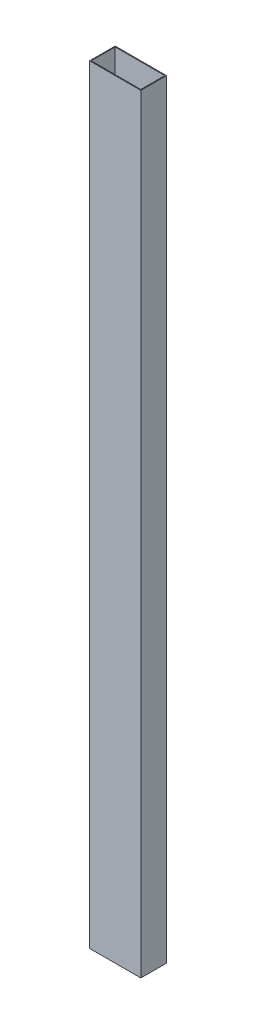
from build123d import *

# Parameters (mm, degrees)
SKETCH1_W           = 50.8
SKETCH1_H           = 25.4
BOSS_EXTRUDE1_DEPTH = 762
SKETCH2_W           = 49.1998
SKETCH2_H           = 23.7998
CUT_EXTRUDE1_DEPTH  = 763.528983056


with BuildPart() as part:
    # Sketch1 → Boss-Extrude1 (new body)
    with BuildSketch(Plane(origin=(0, 0, 0), x_dir=(1, 0, 0), z_dir=(0, 1, 0))):
        Rectangle(SKETCH1_W, SKETCH1_H)
    extrude(amount=BOSS_EXTRUDE1_DEPTH)

    # Sketch2 → Cut-Extrude1 (cut, through all)
    with BuildSketch(Plane.XZ):
        Rectangle(SKETCH2_W, SKETCH2_H)
    extrude(amount=-CUT_EXTRUDE1_DEPTH, mode=Mode.SUBTRACT)


solid = part.part
